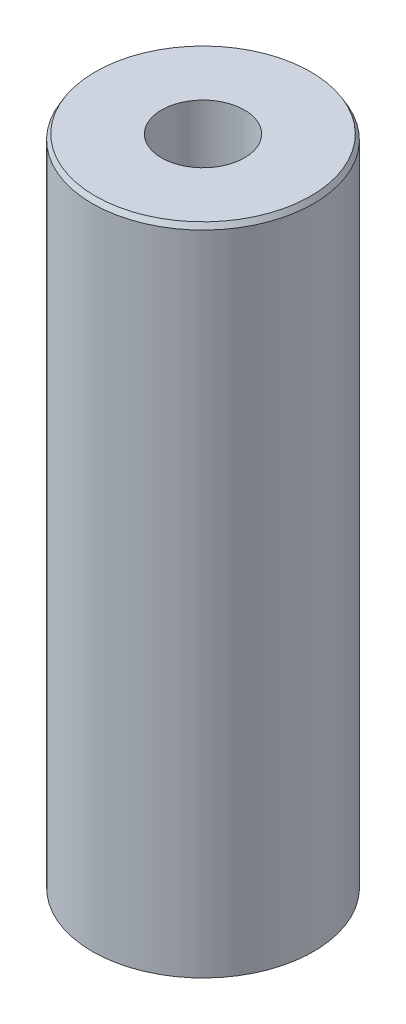
from build123d import *
from OCP.BRepFilletAPI import BRepFilletAPI_MakeChamfer

# Parameters (mm, degrees)
SKETCH1_R           = 55
BOSS_EXTRUDE1_DEPTH = 326.005846533
SKETCH2_R           = 20.629489978
CUT_EXTRUDE1_DEPTH  = 336.156399273
CHAMFER1_SIZE       = 2.527442329
CHAMFER1_SIZE2      = 1.459219509


with BuildPart() as part:
    # Sketch1 → Boss-Extrude1 (new body)
    with BuildSketch(Plane(origin=(0, 0, 0), x_dir=(1, 0, 0), z_dir=(0, 1, 0))):
        Circle(SKETCH1_R)
    extrude(amount=BOSS_EXTRUDE1_DEPTH)

    # Sketch2 → Cut-Extrude1 (cut, through all)
    with BuildSketch(Plane(origin=(0, 0, 0), x_dir=(1, 0, 0), z_dir=(0, 1, 0))):
        Circle(SKETCH2_R)
    extrude(amount=CUT_EXTRUDE1_DEPTH, mode=Mode.SUBTRACT)

    # Chamfer1: one chamfer whose edges measure the first distance from different faces: ONE call of the kernel's chamfer builder (chamfer() names one face for all edges)
    chamfer1_edges_1 = [part.edges().sort_by_distance(p)[0] for p in [
        (-55, 326.005846533, 0),
    ]]
    chamfer1_side_1 = [part.faces().sort_by_distance(p)[0] for p in [
        (-55, 163.002923267, 0),
    ]]
    chamfer1_edges_2 = [part.edges().sort_by_distance(p)[0] for p in [
        (-55, 0, 0),
    ]]
    chamfer1_side_2 = [part.faces().sort_by_distance(p)[0] for p in [
        (-53.444365081, 0, 0),
    ]]
    chamfer1 = BRepFilletAPI_MakeChamfer(part.part.solid().wrapped)
    for e in chamfer1_edges_1:
        chamfer1.Add(CHAMFER1_SIZE, CHAMFER1_SIZE2, e.wrapped, chamfer1_side_1[0].wrapped)  # the first distance lies on this face
    for e in chamfer1_edges_2:
        chamfer1.Add(CHAMFER1_SIZE, CHAMFER1_SIZE2, e.wrapped, chamfer1_side_2[0].wrapped)  # the first distance lies on this face
    add(Compound.cast(chamfer1.Shape()), mode=Mode.REPLACE)


solid = part.part
